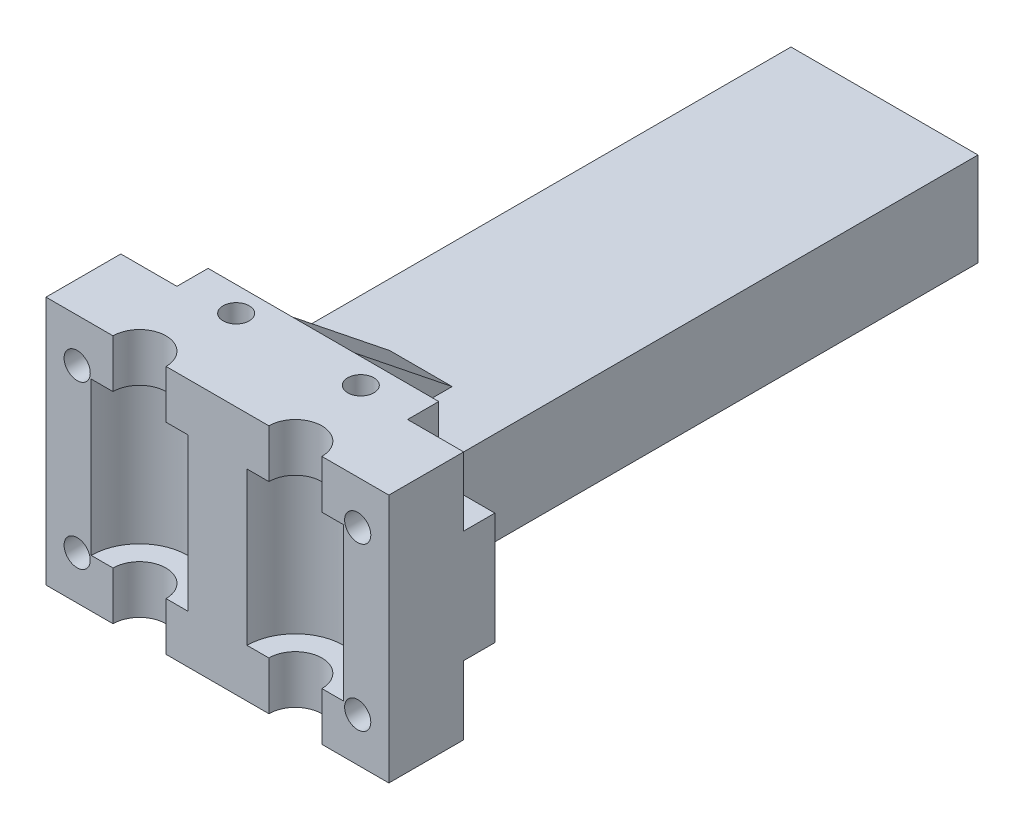
from build123d import *
from build123d.topology import SkipClean

# Parameters (mm, degrees)
ESQUISSE1_W              = 55
ESQUISSE1_H              = 45
BOSS_EXTRU_1_DEPTH       = 12
ESQUISSE2_R              = 4.25
ENL_V_MAT_EXTRU_1_DEPTH  = 55.085580333
ESQUISSE3_R              = 7.75
ENL_V_MAT_EXTRU_2_DEPTH  = 12.25
ESQUISSE9_W              = 61.062756781
ESQUISSE9_H              = 12.22812859
ESQUISSE9_W_2            = 59.427147224
ESQUISSE9_H_2            = 8.100161614
ENL_V_MAT_EXTRU_7_DEPTH  = 31
SKETCH1_W                = 55
SKETCH1_H                = 36
BOSS_EXTRUDE1_DEPTH      = 5
SKETCH2_R                = 2.1
CUT_EXTRUDE1_DEPTH       = 38.003378224
SKETCH3_R                = 4
CUT_EXTRUDE2_DEPTH       = 10
CUT_EXTRUDE3_DEPTH       = 5
SKETCH5_R                = 2.1
CUT_EXTRUDE4_DEPTH       = 47.864165415
BOSS_EXTRUDE4_START      = 2
SKETCH7_R                = 2.1
BOSS_EXTRUDE4_DEPTH      = 2
SKETCH8_R                = 2.1
BOSS_EXTRUDE5_DEPTH      = 2
SKETCH9_W                = 7
SKETCH9_H                = 3.2
CUT_EXTRUDE6_DEPTH       = 8
SKETCH10_W               = 30
SKETCH10_H               = 15
BOSS_EXTRUDE6_DEPTH      = 90
BOSS_EXTRUDE7_DEPTH      = 5
BOSS_EXTRUDE7_DEPTH_BACK = 5


with BuildPart() as part:
    # Esquisse1 → Boss.-Extru.1 (new body)
    with BuildSketch(Plane.XY):
        Rectangle(ESQUISSE1_W, ESQUISSE1_H)
    extrude(amount=BOSS_EXTRU_1_DEPTH)

    # Esquisse2 → Enlèv. mat.-Extru.1 (cut, through all)
    with BuildSketch(Plane(origin=(0, 22.5, 0), x_dir=(1, 0, 0), z_dir=(0, 1, 0))):
        with Locations((-12.5, -12)):
            Circle(ESQUISSE2_R)
        with Locations((12.5, -12)):
            Circle(ESQUISSE2_R)
    extrude(amount=-ENL_V_MAT_EXTRU_1_DEPTH, mode=Mode.SUBTRACT)

    # Esquisse3 → Enlèv. mat.-Extru.2 (cut, symmetric)
    with BuildSketch(Plane(origin=(0, 0, 0), x_dir=(1, 0, 0), z_dir=(0, 1, 0))):
        with Locations((-12.5, -12)):
            Circle(ESQUISSE3_R)
    enl_v_mat_extru_2 = extrude(amount=ENL_V_MAT_EXTRU_2_DEPTH, both=True, mode=Mode.SUBTRACT)

    # Esquisse9 → Enlèv. mat.-Extru.7 (cut)
    with BuildSketch(Plane.XY.offset(12)):
        with Locations((-0.389430846, -24.114064295)):
            Rectangle(ESQUISSE9_W, ESQUISSE9_H)
        with Locations((1.674552641, 22.050080807)):
            Rectangle(ESQUISSE9_W_2, ESQUISSE9_H_2)
    extrude(amount=-ENL_V_MAT_EXTRU_7_DEPTH, mode=Mode.SUBTRACT)

    # Sketch1 → Boss-Extrude1 (add)
    with BuildSketch(Plane(origin=(0, 0, 0), x_dir=(-1, 0, 0), z_dir=(0, 0, -1))):
        Rectangle(SKETCH1_W, SKETCH1_H)
    extrude(amount=BOSS_EXTRUDE1_DEPTH)

    # Sketch2 → Cut-Extrude1 (cut, through all)
    with BuildSketch(Plane.XY.offset(12)):
        with Locations((-22.5, 13)):
            Circle(SKETCH2_R)
        with Locations((22.5, 13)):
            Circle(SKETCH2_R)
        with Locations((22.5, -13)):
            Circle(SKETCH2_R)
        with Locations((-22.5, -13)):
            Circle(SKETCH2_R)
    extrude(amount=-CUT_EXTRUDE1_DEPTH, mode=Mode.SUBTRACT)

    # Sketch3 → Cut-Extrude2 (cut)
    with BuildSketch(Plane(origin=(0, 0, -5), x_dir=(-1, 0, 0), z_dir=(0, 0, -1))):
        with Locations((-22.5, 13)):
            Circle(SKETCH3_R)
        with Locations((22.5, 13)):
            Circle(SKETCH3_R)
        with Locations((22.5, -13)):
            Circle(SKETCH3_R)
        with Locations((-22.5, -13)):
            Circle(SKETCH3_R)
    extrude(amount=-CUT_EXTRUDE2_DEPTH, mode=Mode.SUBTRACT)

    # Sketch4 → Cut-Extrude3 (cut)
    with BuildSketch(Plane(origin=(0, 0, -5), x_dir=(-1, 0, 0), z_dir=(0, 0, -1))):
        with BuildLine():
            Line((-18.5, 13), (-18.5, 18))
            Line((-18.5, 18), (-27.5, 18))
            Line((-27.5, 18), (-27.5, 9))
            Line((-27.5, 9), (-22.5, 9))
            ThreePointArc((-22.5, 9), (-25.328427125, 15.828427125), (-18.5, 13))
        make_face()
        with BuildLine():
            Line((-22.5, -9), (-27.5, -9))
            Line((-27.5, -9), (-27.5, -18))
            Line((-27.5, -18), (-18.5, -18))
            Line((-18.5, -18), (-18.5, -13))
            ThreePointArc((-18.5, -13), (-25.328427125, -15.828427125), (-22.5, -9))
        make_face()
        with BuildLine():
            Line((27.5, -18), (27.5, -9))
            Line((27.5, -9), (22.5, -9))
            ThreePointArc((22.5, -9), (25.328427125, -15.828427125), (18.5, -13))
            Line((18.5, -13), (18.5, -18))
            Line((18.5, -18), (27.5, -18))
        make_face()
        with BuildLine():
            Line((27.5, 18), (18.5, 18))
            Line((18.5, 18), (18.5, 13))
            ThreePointArc((18.5, 13), (25.328427125, 15.828427125), (22.5, 9))
            Line((22.5, 9), (27.5, 9))
            Line((27.5, 9), (27.5, 18))
        make_face()
    extrude(amount=-CUT_EXTRUDE3_DEPTH, mode=Mode.SUBTRACT)

    # Sketch5 → Cut-Extrude4 (cut, through all)
    with BuildSketch(Plane(origin=(0, 18, 0), x_dir=(1, 0, 0), z_dir=(0, 1, 0))):
        with Locations((-10, 1)):
            Circle(SKETCH5_R)
        with Locations((10, 1)):
            Circle(SKETCH5_R)
    extrude(amount=-CUT_EXTRUDE4_DEPTH, mode=Mode.SUBTRACT)

    # Sketch7 → Boss-Extrude4 (add)
    with SkipClean():  # the faces are left unmerged after this step: merging them gives an invalid solid
        with BuildSketch(Plane(origin=(0, 18, 0), x_dir=(1, 0, 0), z_dir=(0, 1, 0)).offset(BOSS_EXTRUDE4_START)):
            with BuildLine():
                Line((18.5, 5), (-18.5, 5))
                Line((-18.5, 5), (-18.5, 0))
                Line((-18.5, 0), (-27.5, 0))
                Line((-27.5, 0), (-27.5, -12))
                Line((-27.5, -12), (-16.75, -12))
                ThreePointArc((-16.75, -12), (-12.5, -7.75), (-8.25, -12))
                Line((-8.25, -12), (8.25, -12))
                ThreePointArc((8.25, -12), (12.5, -7.75), (16.75, -12))
                Line((16.75, -12), (27.5, -12))
                Line((27.5, -12), (27.5, 0))
                Line((27.5, 0), (18.5, 0))
                Line((18.5, 0), (18.5, 5))
            make_face()
            with Locations((10, 1)):
                Circle(SKETCH7_R, mode=Mode.SUBTRACT)
            with Locations((-10, 1)):
                Circle(SKETCH7_R, mode=Mode.SUBTRACT)
        extrude(amount=-BOSS_EXTRUDE4_DEPTH)
    add(part.part.scale(1), mode=Mode.REPLACE)  # the faces are merged on a copy

    # Sketch8 → Boss-Extrude5 (add)
    with BuildSketch(Plane.XZ.offset(18)):
        with BuildLine():
            Line((-27.5, 0), (-18.5, 0))
            Line((-18.5, 0), (-18.5, -5))
            Line((-18.5, -5), (18.5, -5))
            Line((18.5, -5), (18.5, 0))
            Line((18.5, 0), (27.5, 0))
            Line((27.5, 0), (27.5, 12))
            Line((27.5, 12), (16.75, 12))
            ThreePointArc((16.75, 12), (12.5, 7.75), (8.25, 12))
            Line((8.25, 12), (-8.25, 12))
            ThreePointArc((-8.25, 12), (-12.5, 7.75), (-16.75, 12))
            Line((-16.75, 12), (-27.5, 12))
            Line((-27.5, 12), (-27.5, 0))
        make_face()
        with Locations((10, -1)):
            Circle(SKETCH8_R, mode=Mode.SUBTRACT)
        with Locations((-10, -1)):
            Circle(SKETCH8_R, mode=Mode.SUBTRACT)
    extrude(amount=BOSS_EXTRUDE5_DEPTH)

    # Sketch9 → Cut-Extrude6 (cut)
    with BuildSketch(Plane(origin=(0, 0, -5), x_dir=(-1, 0, 0), z_dir=(0, 0, -1))):
        with Locations((-10, 14.4)):
            Rectangle(SKETCH9_W, SKETCH9_H)
        with Locations((10, 14.4)):
            Rectangle(SKETCH9_W, SKETCH9_H)
        with Locations((10, -14.4)):
            Rectangle(SKETCH9_W, SKETCH9_H)
        with Locations((-10, -14.4)):
            Rectangle(SKETCH9_W, SKETCH9_H)
    extrude(amount=-CUT_EXTRUDE6_DEPTH, mode=Mode.SUBTRACT)

    # Mirror1: Enlèv. mat.-Extru.2 across plane
    add(enl_v_mat_extru_2.mirror(Plane.ZY), mode=Mode.SUBTRACT)

    # Sketch10 → Boss-Extrude6 (add)
    with BuildSketch(Plane(origin=(0, 0, -5), x_dir=(-1, 0, 0), z_dir=(0, 0, -1))):
        Rectangle(SKETCH10_W, SKETCH10_H)
    extrude(amount=BOSS_EXTRUDE6_DEPTH)

    # Sketch11 → Boss-Extrude7 (add, two sides: drawn at the far end of the back side and taken through both)
    with BuildSketch(Plane.ZY.offset(-BOSS_EXTRUDE7_DEPTH_BACK)):
        Polygon((-5, 7.5), (-20.649753688, 7.5), (-5, 20), align=None)
    extrude(amount=BOSS_EXTRUDE7_DEPTH + BOSS_EXTRUDE7_DEPTH_BACK)


solid = part.part
